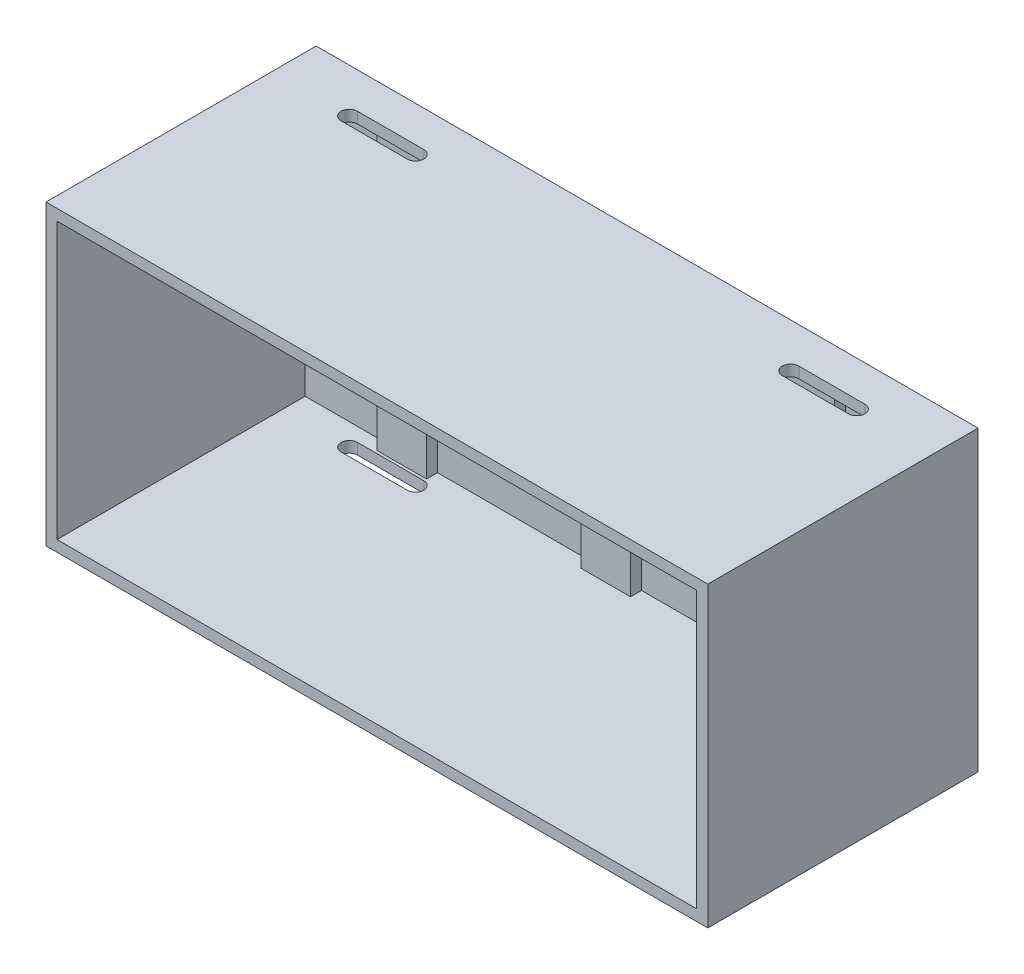
from build123d import *

# Parameters (mm, degrees)
SKETCH1_W           = 120
SKETCH1_H           = 54
BOSS_EXTRUDE1_DEPTH = 4
SKETCH2_W           = 120
SKETCH2_H           = 54
SKETCH2_W_2         = 116
SKETCH2_H_2         = 50
BOSS_EXTRUDE2_DEPTH = 45
SKETCH3_W           = 9
SKETCH3_H           = 50
BOSS_EXTRUDE3_DEPTH = 2
CUT_EXTRUDE3_DEPTH  = 14
CUT_EXTRUDE4_START  = -14
CUT_EXTRUDE4_DEPTH  = 14
SKETCH4_R           = 1.65
CUT_EXTRUDE5_DEPTH  = 14


with BuildPart() as part:
    # Sketch1 → Boss-Extrude1 (new body)
    with BuildSketch(Plane.XY):
        with Locations((-20.747252747, 20)):
            Rectangle(SKETCH1_W, SKETCH1_H)
    extrude(amount=BOSS_EXTRUDE1_DEPTH)

    # Sketch2 → Boss-Extrude2 (add)
    with BuildSketch(Plane.XY.offset(4)):
        with Locations((-20.747252747, 20)):
            Rectangle(SKETCH2_W, SKETCH2_H)
        with Locations((-20.747252747, 20)):
            Rectangle(SKETCH2_W_2, SKETCH2_H_2, mode=Mode.SUBTRACT)
    extrude(amount=BOSS_EXTRUDE2_DEPTH)

    # Sketch3 → Boss-Extrude3 (add)
    with BuildSketch(Plane.XY.offset(4)):
        with Locations((-59.247252747, 20)):
            Rectangle(SKETCH3_W, SKETCH3_H)
        with Locations((-22.247252747, 20)):
            Rectangle(SKETCH3_W, SKETCH3_H)
        with Locations((14.752747253, 20)):
            Rectangle(SKETCH3_W, SKETCH3_H)
    extrude(amount=BOSS_EXTRUDE3_DEPTH)

    # Sketch6 → Cut-Extrude3 (cut)
    with BuildSketch(Plane(origin=(0, -7, 0), x_dir=(-1, 0, 0), z_dir=(0, -1, 0))):
        with BuildLine():
            Line((66.747252747, -9.5), (54.747252747, -9.5))
            ThreePointArc((54.747252747, -9.5), (53.247252747, -8), (54.747252747, -6.5))
            Line((54.747252747, -6.5), (66.747252747, -6.5))
            ThreePointArc((66.747252747, -6.5), (68.247252747, -8), (66.747252747, -9.5))
        make_face()
        with BuildLine():
            Line((-13.252747253, -9.5), (-25.252747253, -9.5))
            ThreePointArc((-25.252747253, -9.5), (-26.752747253, -8), (-25.252747253, -6.5))
            Line((-25.252747253, -6.5), (-13.252747253, -6.5))
            ThreePointArc((-13.252747253, -6.5), (-11.752747253, -8), (-13.252747253, -9.5))
        make_face()
    extrude(amount=-CUT_EXTRUDE3_DEPTH, mode=Mode.SUBTRACT)

    # Sketch7 → Cut-Extrude4 (cut)
    with BuildSketch(Plane(origin=(0, 47, 0), x_dir=(1, 0, 0), z_dir=(0, 1, 0)).offset(CUT_EXTRUDE4_START)):
        with BuildLine():
            Line((13.252747253, -9.5), (25.252747253, -9.5))
            ThreePointArc((25.252747253, -9.5), (26.752747253, -8), (25.252747253, -6.5))
            Line((25.252747253, -6.5), (13.252747253, -6.5))
            ThreePointArc((13.252747253, -6.5), (11.752747253, -8), (13.252747253, -9.5))
        make_face()
        with BuildLine():
            Line((-66.747252747, -9.5), (-54.747252747, -9.5))
            ThreePointArc((-54.747252747, -9.5), (-53.247252747, -8), (-54.747252747, -6.5))
            Line((-54.747252747, -6.5), (-66.747252747, -6.5))
            ThreePointArc((-66.747252747, -6.5), (-68.247252747, -8), (-66.747252747, -9.5))
        make_face()
    extrude(amount=CUT_EXTRUDE4_DEPTH, mode=Mode.SUBTRACT)

    # Sketch4 → Cut-Extrude5 (cut)
    with BuildSketch(Plane.XY.offset(4)):
        with Locations((-4.74254548, 39.5)):
            Circle(SKETCH4_R)
        with Locations((-42.205415824, 39.5)):
            Circle(SKETCH4_R)
        with Locations((-72.673636324, 39.5)):
            Circle(SKETCH4_R)
        with Locations((29.282276635, 39.5)):
            Circle(SKETCH4_R)
    extrude(amount=-CUT_EXTRUDE5_DEPTH, mode=Mode.SUBTRACT)


solid = part.part
